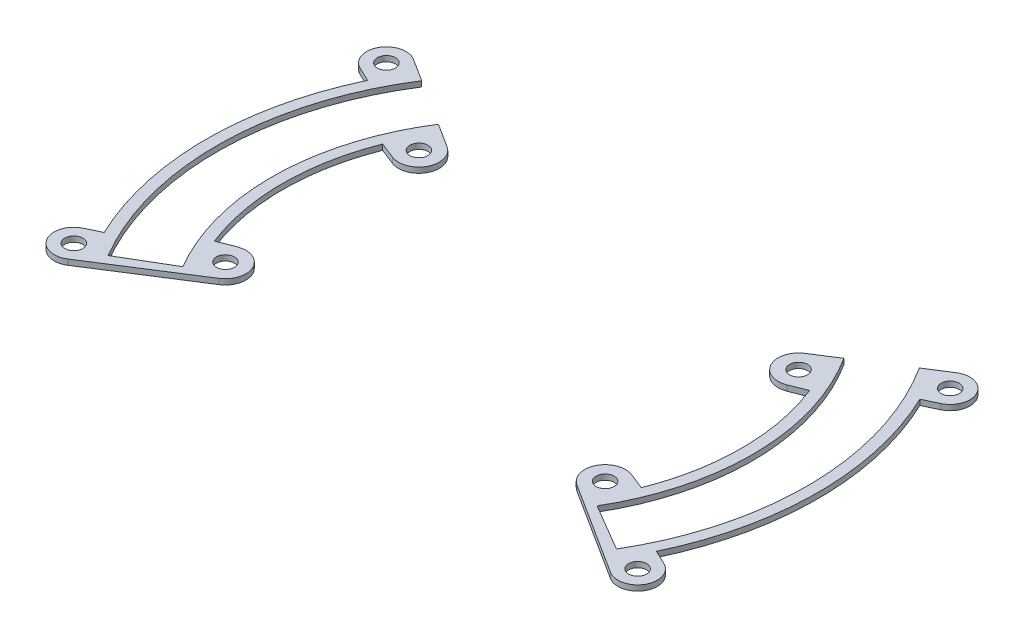
from build123d import *

# Parameters (mm, degrees)
SKETCH1_R           = 1.65
BOSS_EXTRUDE1_DEPTH = 1


with BuildPart() as part:
    # Sketch1 → Boss-Extrude1 (new body)
    with BuildSketch(Plane(origin=(0, 0, 0), x_dir=(1, 0, 0), z_dir=(0, 1, 0))):
        with BuildLine():
            Line((50.544775924, 24.108621421), (53.15320507, 25.352778303))
            ThreePointArc((53.15320507, 25.352778303), (54.752823812, 30.349985831), (49.667282695, 31.64154874))
            Line((49.667282695, 31.64154874), (45.543138074, 29.014178851))
            ThreePointArc((45.543138074, 29.014178851), (53.991775538, 0.942429948), (46.527974664, -27.4070716))
            Line((46.527974664, -27.4070716), (37.911683059, -22.33168797))
            ThreePointArc((37.911683059, -22.33168797), (43.993298587, 0.767905883), (37.109223616, 23.641182767))
            Line((37.109223616, 23.641182767), (32.740836917, 20.858213514))
            ThreePointArc((32.740836917, 20.858213514), (31.418686002, 16.008620108), (36.119230292, 14.227743183))
            Line((36.119230292, 14.227743183), (39.077537855, 15.393051522))
            ThreePointArc((39.077537855, 15.393051522), (42, 0), (39.077537855, -15.393051522))
            Line((39.077537855, -15.393051522), (36.119230292, -14.227743183))
            ThreePointArc((36.119230292, -14.227743183), (31.418686002, -16.008620108), (32.740836917, -20.858213514))
            Line((32.740836917, -20.858213514), (49.667282695, -31.64154874))
            ThreePointArc((49.667282695, -31.64154874), (54.752823812, -30.349985831), (53.15320507, -25.352778303))
            Line((53.15320507, -25.352778303), (50.544775924, -24.108621421))
            ThreePointArc((50.544775924, -24.108621421), (56, 0), (50.544775924, 24.108621421))
        make_face()
        with Locations((34.749254443, -17.70562949)):
            Circle(SKETCH1_R, mode=Mode.SUBTRACT)
        with Locations((51.602562721, -28.603767595)):
            Circle(SKETCH1_R, mode=Mode.SUBTRACT)
        with Locations((34.749254443, 17.70562949)):
            Circle(SKETCH1_R, mode=Mode.SUBTRACT)
        with Locations((51.602562721, 28.603767595)):
            Circle(SKETCH1_R, mode=Mode.SUBTRACT)
    extrude(amount=BOSS_EXTRUDE1_DEPTH)


with BuildPart() as body_2:
    # Mirror2: mirrored copy
    add(part.part.mirror(Plane(origin=(0, 0, 0), x_dir=(0, 0, 1), z_dir=(1, 0, 0))))


solid = Compound([part.part, body_2.part])
